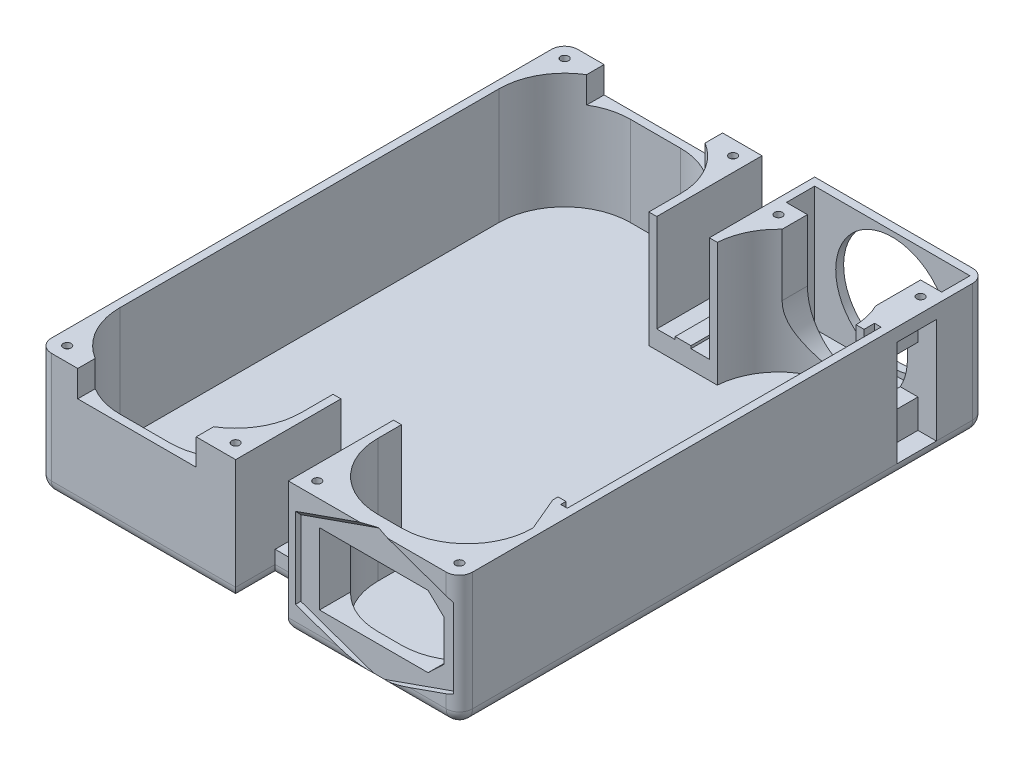
from build123d import *
from build123d.topology import SkipClean

# Parameters (mm, degrees)
BOSS_BASE_DEPTH     = 3
MOUNT_POINTS_W      = 20
MOUNT_POINTS_H      = 25
BOSS_2040REST_DEPTH = 7
SKETCH5_W           = 6
SKETCH5_H           = 25
BOSS_2040RAIL_DEPTH = 1
CUT_EXTRUDE1_REACH  = 133.704
SKETCH6_R           = 1.65
SKETCH7_R           = 3
CUT_EXTRUDE2_DEPTH  = 8
BOSS_EXTRUDE4_DEPTH = 44
BOSS_EXTRUDE5_DEPTH = 47
FILLET2_R           = 25
SKETCH14_W          = 59
SKETCH14_H          = 3
BOSS_EXTRUDE6_DEPTH = 47
CUT_EXTRUDE4_DEPTH  = 2
CHAMFER1_SIZE       = 2
CUT_EXTRUDE5_REACH  = 223.199
SKETCH15_R          = 21.5
CUT_EXTRUDE6_DEPTH  = 209.099885872
CUT_EXTRUDE7_REACH  = 210.1
SKETCH16_W          = 43
SKETCH16_H          = 23.5
BOSS_EXTRUDE7_DEPTH = 47
SKETCH20_W          = 45
SKETCH20_H          = 10
CUT_EXTRUDE10_DEPTH = 223.99103121
FILLET3_START       = 2
FILLET3_DEPTH       = 48
FILLET3_2_DEPTH     = 3.641900088
FILLET3_START_2     = 5.641900088
FILLET3_3_DEPTH     = 20.858099912
FILLET3_START_3     = -83.25
FILLET3_4_DEPTH     = 14.061537587
FILLET4_R           = 25
FILLET5_R           = 5
SKETCH23_W          = 15
SKETCH23_H          = 40
CUT_EXTRUDE11_DEPTH = 7
SKETCH19_R          = 1.5
SCREWHOLES_DEPTH    = 5
CUT_EXTRUDE12_REACH = 191.497
SKETCH24_W          = 15
SKETCH24_H          = 18


with BuildPart() as part:
    # base → boss-base (new body)
    with BuildSketch(Plane(origin=(0, 0, 0), x_dir=(1, 0, 0), z_dir=(0, 1, 0))):
        Polygon((10, 85), (-10, 85), (-10, 100), (-85, 100), (-85, -100), (-10, -100), (-10, -85), (10, -85), (10, -100), (75, -100), (75, 100), (10, 100), align=None)
    extrude(amount=BOSS_BASE_DEPTH)

    # mount points → Boss-2040rest (add)
    with BuildSketch(Plane(origin=(0, 3, 0), x_dir=(1, 0, 0), z_dir=(0, 1, 0))):
        with Locations((0, 72.5)):
            Rectangle(MOUNT_POINTS_W, MOUNT_POINTS_H)
        with Locations((0, -72.5)):
            Rectangle(MOUNT_POINTS_W, MOUNT_POINTS_H)
    extrude(amount=BOSS_2040REST_DEPTH)

    # Sketch5 → Boss-2040rail (add)
    with BuildSketch(Plane(origin=(0, 10, 0), x_dir=(1, 0, 0), z_dir=(0, 1, 0))):
        with Locations((0, -72.5)):
            Rectangle(SKETCH5_W, SKETCH5_H)
        with Locations((0, 72.5)):
            Rectangle(SKETCH5_W, SKETCH5_H)
    extrude(amount=BOSS_2040RAIL_DEPTH)

    # Sketch6 → Cut-Extrude1 (cut, up to next)
    with BuildSketch(Plane(origin=(0, 11, 0), x_dir=(1, 0, 0), z_dir=(0, 1, 0)), mode=Mode.PRIVATE) as cut_extrude1_sk1:
        with Locations(Location((0, 72.5, 0), (0, 0, 270))):
            Circle(SKETCH6_R)
    cut_extrude1_tool1 = extrude(cut_extrude1_sk1.sketch, amount=-CUT_EXTRUDE1_REACH, mode=Mode.PRIVATE) & part.part
    # Sketch6 → Cut-Extrude1 (cut, up to next)
    with BuildSketch(Plane(origin=(0, 11, 0), x_dir=(1, 0, 0), z_dir=(0, 1, 0)), mode=Mode.PRIVATE) as cut_extrude1_sk2:
        with Locations(Location((0, -72.5, 0), (0, 0, 270))):
            Circle(SKETCH6_R)
    cut_extrude1_tool2 = extrude(cut_extrude1_sk2.sketch, amount=-CUT_EXTRUDE1_REACH, mode=Mode.PRIVATE) & part.part
    add(cut_extrude1_tool1.solids().sort_by_distance((0, 11, -72.5))[0], mode=Mode.SUBTRACT)
    add(cut_extrude1_tool2.solids().sort_by_distance((0, 11, 72.5))[0], mode=Mode.SUBTRACT)

    # Sketch7 → Cut-Extrude2 (cut)
    with BuildSketch(Plane.XZ):
        with Locations(Location((0, 72.5, 0), (0, 0, 270))):
            Circle(SKETCH7_R)
        with Locations(Location((0, -72.5, 0), (0, 0, 270))):
            Circle(SKETCH7_R)
    extrude(amount=-CUT_EXTRUDE2_DEPTH, mode=Mode.SUBTRACT)

    # Sketch9 → Boss-Extrude4 (add)
    with BuildSketch(Plane(origin=(0, 3, 0), x_dir=(1, 0, 0), z_dir=(0, 1, 0))):
        Polygon((-10, 100), (-85, 100), (-85, -100), (-10, -100), (-10, -85), (-10, -60), (-13, -60), (-13, -85), (-13, -97), (-82, -97), (-82, 97), (-13, 97), (-13, 85), (-13, 60), (-10, 60), (-10, 85), align=None)
    extrude(amount=BOSS_EXTRUDE4_DEPTH)

    # Sketch10 → Boss-Extrude5 (add)
    with BuildSketch(Plane(origin=(0, 3, 0), x_dir=(1, 0, 0), z_dir=(0, 1, 0))):
        Polygon((10, -85), (10, -60), (13, -60), (13, -85), (13, -94), (72, -94), (72, 97), (13, 97), (13, 85), (13, 60), (10, 60), (10, 85), (10, 100), (75, 100), (75, -100), (10, -100), align=None)
    extrude(amount=BOSS_EXTRUDE5_DEPTH)

    # Fillet2
    fillet2_edges = [part.edges().sort_by_distance(p)[0] for p in [
        (72, 26.5, 94),
        (13, 26.5, 94),
    ]]
    fillet(fillet2_edges, radius=FILLET2_R)

    # Sketch14 → Boss-Extrude6 (add)
    with BuildSketch(Plane(origin=(0, 3, 0), x_dir=(1, 0, 0), z_dir=(0, 1, 0))):
        with Locations((42.5, 84.75)):
            Rectangle(SKETCH14_W, SKETCH14_H)
    extrude(amount=BOSS_EXTRUDE6_DEPTH)

    # Sketch11 → Cut-Extrude4 (cut)
    with BuildSketch(Plane.XY.offset(100)):
        Polygon((12.75, 10.75), (12.75, 39.25), (42.5, 49.75), (72.25, 39.25), (72.25, 10.75), (42.5, 0.25), align=None)
    extrude(amount=-CUT_EXTRUDE4_DEPTH, mode=Mode.SUBTRACT)

    # Chamfer1
    # the kernel refuses this chamfer: 2 mm, written as the material it takes off along each edge
    with BuildSketch(Plane(origin=(37.649855603, 51.46181567, 100), x_dir=(0.3328201177351373, 0.9429903335828895, -7.105427357600988e-15), z_dir=(0.9429903335828896, -0.33282011773513737, 0))) as chamfer1_piece_1_section:
        Polygon((CHAMFER1_SIZE, 0), (0, -CHAMFER1_SIZE), (0, 0), align=None)
    chamfer1_piece_1 = extrude(amount=41.835305612, mode=Mode.PRIVATE)
    chamfer1_piece_1 = split(chamfer1_piece_1, bisect_by=Plane(origin=(38.724349131, 48.41741734, 100), z_dir=(0.3328201177351376, -0.9429903335828895, 0)), keep=Keep.TOP, mode=Mode.PRIVATE)
    chamfer1_piece_1 = split(chamfer1_piece_1, bisect_by=Plane(origin=(72.25, 51.46181567, 100), z_dir=(-1, 0, 0)), keep=Keep.TOP, mode=Mode.PRIVATE)
    add(chamfer1_piece_1, mode=Mode.SUBTRACT)
    with BuildSketch(Plane(origin=(7.899855603, 37.53818433, 100), x_dir=(-0.3328201177351376, 0.9429903335828896, 0), z_dir=(0.9429903335828895, 0.3328201177351376, 0))) as chamfer1_piece_2_section:
        Polygon((CHAMFER1_SIZE, 0), (0, -CHAMFER1_SIZE), (0, 0), align=None)
    chamfer1_piece_2 = extrude(amount=41.835305612, mode=Mode.PRIVATE)
    chamfer1_piece_2 = split(chamfer1_piece_2, bisect_by=Plane(origin=(12.75, 37.53818433, 100), z_dir=(1, 0, 0)), keep=Keep.TOP, mode=Mode.PRIVATE)
    chamfer1_piece_2 = split(chamfer1_piece_2, bisect_by=Plane(origin=(15.565118361, 59.256428814, 100), z_dir=(-0.33282011773513737, -0.9429903335828896, 0)), keep=Keep.TOP, mode=Mode.PRIVATE)
    add(chamfer1_piece_2, mode=Mode.SUBTRACT)
    with BuildSketch(Plane(origin=(7.899855603, 37.53818433, 100), x_dir=(-0.3328201177351376, 0.9429903335828896, 0), z_dir=(0.9429903335828895, 0.3328201177351376, 0))) as chamfer1_piece_3a_section:
        Polygon((CHAMFER1_SIZE, 0), (0, -CHAMFER1_SIZE), (0, 0), align=None)
    chamfer1_piece_3a = extrude(amount=41.835305612, mode=Mode.PRIVATE)
    chamfer1_piece_3a = split(chamfer1_piece_3a, bisect_by=Plane(origin=(7.899855603, 50, 100), z_dir=(0, -1, 0)), keep=Keep.TOP, mode=Mode.PRIVATE)
    chamfer1_piece_3a = split(chamfer1_piece_3a, bisect_by=Plane(origin=(15.565118361, 59.256428814, 100), z_dir=(0.33282011773513737, 0.9429903335828896, 0)), keep=Keep.TOP, mode=Mode.PRIVATE)
    with BuildSketch(Plane(origin=(37.649855603, 51.46181567, 100), x_dir=(0.3328201177351373, 0.9429903335828895, -7.105427357600988e-15), z_dir=(0.9429903335828896, -0.33282011773513737, 0))) as chamfer1_piece_3b_section:
        Polygon((CHAMFER1_SIZE, 0), (0, -CHAMFER1_SIZE), (0, 0), align=None)
    chamfer1_piece_3b = extrude(amount=41.835305612, mode=Mode.PRIVATE)
    chamfer1_piece_3b = split(chamfer1_piece_3b, bisect_by=Plane(origin=(37.649855603, 50, 100), z_dir=(0, -1, 0)), keep=Keep.TOP, mode=Mode.PRIVATE)
    chamfer1_piece_3b = split(chamfer1_piece_3b, bisect_by=Plane(origin=(38.724349131, 48.41741734, 100), z_dir=(-0.3328201177351376, 0.9429903335828895, 0)), keep=Keep.TOP, mode=Mode.PRIVATE)
    chamfer1_piece_3 = chamfer1_piece_3a & chamfer1_piece_3b
    add(chamfer1_piece_3, mode=Mode.SUBTRACT)

    # Sketch12 → Cut-Extrude5 (cut, up to next)
    with BuildSketch(Plane.XY.offset(98), mode=Mode.PRIVATE) as cut_extrude5_sk1:
        Polygon((19.85, 11.45), (19.85, 38.55), (61.1, 38.55), (67.25, 32.7), (67.25, 17.3), (61.1, 11.45), align=None)
    cut_extrude5_tool1 = extrude(cut_extrude5_sk1.sketch, amount=-CUT_EXTRUDE5_REACH, mode=Mode.PRIVATE) & part.part
    add(cut_extrude5_tool1.solids().sort_by_distance((42.926152, 25, 98))[0], mode=Mode.SUBTRACT)

    # Sketch15 → Cut-Extrude6 (cut, through all)
    with BuildSketch(Plane.XY.offset(-83.25)):
        with Locations((42.5, 26.5)):
            Circle(SKETCH15_R)
    extrude(amount=-CUT_EXTRUDE6_DEPTH, mode=Mode.SUBTRACT)

    # Sketch16 → Cut-Extrude7 (cut, up to next)
    with BuildSketch(Plane.XY.offset(-83.25), mode=Mode.PRIVATE) as cut_extrude7_sk1:
        with Locations((42.5, 38.25)):
            Rectangle(SKETCH16_W, SKETCH16_H)
    cut_extrude7_tool1 = extrude(cut_extrude7_sk1.sketch, amount=-CUT_EXTRUDE7_REACH, mode=Mode.PRIVATE) & part.part
    add(cut_extrude7_tool1.solids().sort_by_distance((42.5, 38.25, -83.25))[0], mode=Mode.SUBTRACT)

    # Sketch17 → Boss-Extrude7 (add)
    with BuildSketch(Plane(origin=(0, 3, 0), x_dir=(1, 0, 0), z_dir=(0, 1, 0))):
        Polygon((72, 63.25), (69.5, 63.25), (69.5, 59.25), (66.5, 59.25), (66.5, 83.25), (72, 83.25), align=None)
        Polygon((72, -56), (69.5, -56), (69.5, -54), (66.5, -54), (66.5, -56), (72, -69), align=None)
    extrude(amount=BOSS_EXTRUDE7_DEPTH)

    # Sketch20 → Cut-Extrude10 (cut, through all)
    with BuildSketch(Plane.XY.offset(100)):
        with Locations((-47.5, 42)):
            Rectangle(SKETCH20_W, SKETCH20_H)
    extrude(amount=-CUT_EXTRUDE10_DEPTH, mode=Mode.SUBTRACT)

    # Fillet3: read off the stored shape, not the designer's step
    # Fillet3 outline → Fillet3 (add)
    with BuildSketch(Plane(origin=(0, 0, 0), x_dir=(1, 0, 0), z_dir=(0, 1, 0)).offset(FILLET3_START)):
        with BuildLine():
            Line((21, 76.636987153), (21, 83.25))
            Line((21, 83.25), (13, 83.25))
            Line((13, 83.25), (13, 60))
            ThreePointArc((13, 60), (15.408130248, 69.083954167), (21, 76.636987153))
        make_face()
        with BuildLine():
            Line((64, 83.25), (64, 69.188462413))
            ThreePointArc((64, 69.188462413), (65.764714208, 64.348706518), (66.5, 59.25))
            Line((66.5, 59.25), (66.5, 83.25))
            Line((66.5, 83.25), (64, 83.25))
        make_face()
    extrude(amount=FILLET3_DEPTH)

    # Fillet3 2 outline → Fillet3 2 (add)
    with BuildSketch(Plane(origin=(0, 0, 0), x_dir=(1, 0, 0), z_dir=(0, 1, 0)).offset(FILLET3_START)):
        with BuildLine():
            Line((37.938674784, 83.25), (21, 83.25))
            Line((21, 83.25), (21, 76.636987153))
            ThreePointArc((21, 76.636987153), (28.84677396, 81.538137311), (37.938674784, 83.25))
        make_face()
        with BuildLine():
            Line((64, 83.25), (41.520008006, 83.25))
            ThreePointArc((41.520008006, 83.25), (54.77780646, 79.445064995), (64, 69.188462413))
            Line((64, 69.188462413), (64, 83.25))
        make_face()
    extrude(amount=FILLET3_2_DEPTH)

    # Fillet3 3 outline → Fillet3 3 (add)
    with BuildSketch(Plane(origin=(0, 0, 0), x_dir=(1, 0, 0), z_dir=(0, 1, 0)).offset(FILLET3_START_2)):
        with BuildLine():
            ThreePointArc((41.520008006, 83.25), (54.77780646, 79.445064995), (64, 69.188462413))
            Line((64, 69.188462413), (64, 83.25))
            Line((64, 83.25), (41.520008006, 83.25))
        make_face()
        with BuildLine():
            Line((21, 83.25), (21, 76.636987153))
            ThreePointArc((21, 76.636987153), (28.84677396, 81.538137311), (37.938674784, 83.25))
            Line((37.938674784, 83.25), (21, 83.25))
        make_face()
    extrude(amount=FILLET3_3_DEPTH)

    # Fillet3 4 outline → Fillet3 4 (cut)
    with SkipClean():  # the faces are left unmerged after this step: merging them gives an invalid solid
        with BuildSketch(Plane.XY.offset(FILLET3_START_3)):
            with BuildLine():
                Line((64, 26.5), (21, 26.5))
                ThreePointArc((21, 26.5), (42.5, 5), (64, 26.5))
            make_face()
        extrude(amount=FILLET3_4_DEPTH, mode=Mode.SUBTRACT)
    add(part.part.scale(1), mode=Mode.REPLACE)  # the faces are merged on a copy

    # Fillet4
    fillet4_edges = [part.edges().sort_by_distance(p)[0] for p in [
        (-13, 25, -97),
        (-82, 25, -97),
        (-13, 25, 97),
        (-82, 25, 97),
    ]]
    fillet(fillet4_edges, radius=FILLET4_R)

    # Fillet5
    # the kernel refuses this fillet: 5 mm, written as the material it takes off along each edge
    with BuildSketch(Plane(origin=(70, 5, -95), x_dir=(1, 0, 0), z_dir=(0, 0, -1))) as fillet5_piece_1_section:
        Polygon((0, 0), (FILLET5_R, 0), (FILLET5_R, FILLET5_R), (0, FILLET5_R), align=None)
    fillet5_piece_1 = extrude(amount=FILLET5_R, mode=Mode.PRIVATE)
    fillet5_piece_1 = fillet5_piece_1 - Plane(origin=(70, 5, -95), x_dir=(-0.7071067811865475, 0.7071067811865475, 0), z_dir=(0, 0, -1)) * Sphere(FILLET5_R, mode=Mode.PRIVATE)
    add(fillet5_piece_1, mode=Mode.SUBTRACT)
    with BuildSketch(Plane(origin=(70, 5, 95), x_dir=(0, 0, 1), z_dir=(1, 0, 0))) as fillet5_piece_2_section:
        Polygon((0, 0), (FILLET5_R, 0), (FILLET5_R, FILLET5_R), (0, FILLET5_R), align=None)
    fillet5_piece_2 = extrude(amount=FILLET5_R, mode=Mode.PRIVATE)
    fillet5_piece_2 = fillet5_piece_2 - Plane(origin=(70, 5, 95), x_dir=(0, 0.7071067811865475, -0.7071067811865475), z_dir=(1, 0, 0)) * Sphere(FILLET5_R, mode=Mode.PRIVATE)
    add(fillet5_piece_2, mode=Mode.SUBTRACT)
    with BuildSketch(Plane(origin=(-80, 5, -95), x_dir=(0, 0, -1), z_dir=(0, -1, 0))) as fillet5_piece_3_section:
        Polygon((0, 0), (FILLET5_R, 0), (FILLET5_R, -FILLET5_R), (0, -FILLET5_R), align=None)
    fillet5_piece_3 = extrude(amount=FILLET5_R, mode=Mode.PRIVATE)
    fillet5_piece_3 = fillet5_piece_3 - Plane(origin=(-80, 5, -95), x_dir=(0.7071067811865477, 0, 0.7071067811865474), z_dir=(0, -1, 0)) * Sphere(FILLET5_R, mode=Mode.PRIVATE)
    add(fillet5_piece_3, mode=Mode.SUBTRACT)
    with BuildSketch(Plane(origin=(-80, 5, 95), x_dir=(0, -1, 0), z_dir=(0, 0, 1))) as fillet5_piece_4_section:
        Polygon((0, 0), (FILLET5_R, 0), (FILLET5_R, -FILLET5_R), (0, -FILLET5_R), align=None)
    fillet5_piece_4 = extrude(amount=FILLET5_R, mode=Mode.PRIVATE)
    fillet5_piece_4 = fillet5_piece_4 - Plane(origin=(-80, 5, 95), x_dir=(0.7071067811865475, 0.7071067811865475, 0), z_dir=(0, 0, 1)) * Sphere(FILLET5_R, mode=Mode.PRIVATE)
    add(fillet5_piece_4, mode=Mode.SUBTRACT)
    with BuildSketch(Plane(origin=(75, 62.5, -100), x_dir=(-1, 0, 0), z_dir=(0, -1, 0))) as fillet5_piece_5:
        with BuildLine():
            CenterArc((FILLET5_R, -FILLET5_R), FILLET5_R, 90, 90)
            Line((0, -FILLET5_R), (0, 0))
            Line((0, 0), (FILLET5_R, 0))
        make_face()
    extrude(amount=57.5, mode=Mode.SUBTRACT)
    with BuildSketch(Plane(origin=(75, 62.5, 100), x_dir=(-1, 0, 0), z_dir=(0, -1, 0))) as fillet5_piece_6:
        with BuildLine():
            CenterArc((FILLET5_R, FILLET5_R), FILLET5_R, 180, 90)
            Line((0, FILLET5_R), (0, 0))
            Line((0, 0), (FILLET5_R, 0))
        make_face()
    extrude(amount=57.5, mode=Mode.SUBTRACT)
    with BuildSketch(Plane(origin=(-85, 5, -100), x_dir=(1, 0, 0), z_dir=(0, 1, 0))) as fillet5_piece_7:
        with BuildLine():
            CenterArc((FILLET5_R, -FILLET5_R), FILLET5_R, 90, 90)
            Line((0, -FILLET5_R), (0, 0))
            Line((0, 0), (FILLET5_R, 0))
        make_face()
    extrude(amount=54.5, mode=Mode.SUBTRACT)
    with BuildSketch(Plane(origin=(-85, 5, 100), x_dir=(1, 0, 0), z_dir=(0, 1, 0))) as fillet5_piece_8:
        with BuildLine():
            CenterArc((FILLET5_R, FILLET5_R), FILLET5_R, 180, 90)
            Line((0, FILLET5_R), (0, 0))
            Line((0, 0), (FILLET5_R, 0))
        make_face()
    extrude(amount=54.5, mode=Mode.SUBTRACT)
    with BuildSketch(Plane(origin=(-80, 0, 100), x_dir=(0, 1, 0), z_dir=(1, 0, 0))) as fillet5_piece_9:
        with BuildLine():
            CenterArc((FILLET5_R, -FILLET5_R), FILLET5_R, 90, 90)
            Line((0, -FILLET5_R), (0, 0))
            Line((0, 0), (FILLET5_R, 0))
        make_face()
    extrude(amount=82.5, mode=Mode.SUBTRACT)
    with BuildSketch(Plane(origin=(-10, 0, 112.5), x_dir=(0, 1, 0), z_dir=(0, 0, -1)), Plane(origin=(10, 0, 85), x_dir=(0, 1, 0), z_dir=(0, 0, 1)), Plane(origin=(10, 0, -112.5), x_dir=(0, 1, 0), z_dir=(0, 0, 1)), Plane(origin=(-10, 0, -85), x_dir=(0, 1, 0), z_dir=(0, 0, -1))) as fillet5_piece_10:
        with BuildLine():
            CenterArc((FILLET5_R, -FILLET5_R), FILLET5_R, 90, 90)
            Line((0, -FILLET5_R), (0, 0))
            Line((0, 0), (FILLET5_R, 0))
        make_face()
    extrude(amount=27.5, mode=Mode.SUBTRACT)
    with BuildSketch(Plane(origin=(-10, 0, 85), x_dir=(0, 1, 0), z_dir=(1, 0, 0))) as fillet5_piece_11:
        with BuildLine():
            CenterArc((FILLET5_R, -FILLET5_R), FILLET5_R, 90, 90)
            Line((0, -FILLET5_R), (0, 0))
            Line((0, 0), (FILLET5_R, 0))
        make_face()
    extrude(amount=20, mode=Mode.SUBTRACT)
    with BuildSketch(Plane(origin=(-2.5, 0, 100), x_dir=(0, 1, 0), z_dir=(1, 0, 0))) as fillet5_piece_12:
        with BuildLine():
            CenterArc((FILLET5_R, -FILLET5_R), FILLET5_R, 90, 90)
            Line((0, -FILLET5_R), (0, 0))
            Line((0, 0), (FILLET5_R, 0))
        make_face()
    extrude(amount=72.5, mode=Mode.SUBTRACT)
    with BuildSketch(Plane(origin=(75, 0, 95), x_dir=(-1, 0, 0), z_dir=(0, 0, -1)), Plane(origin=(-85, 0, -95), x_dir=(1, 0, 0), z_dir=(0, 0, 1))) as fillet5_piece_13:
        with BuildLine():
            CenterArc((FILLET5_R, FILLET5_R), FILLET5_R, 180, 90)
            Line((0, FILLET5_R), (0, 0))
            Line((0, 0), (FILLET5_R, 0))
        make_face()
    extrude(amount=190, mode=Mode.SUBTRACT)
    with BuildSketch(Plane(origin=(70, 0, -100), x_dir=(0, 0, 1), z_dir=(-1, 0, 0))) as fillet5_piece_14:
        with BuildLine():
            CenterArc((FILLET5_R, FILLET5_R), FILLET5_R, 180, 90)
            Line((0, FILLET5_R), (0, 0))
            Line((0, 0), (FILLET5_R, 0))
        make_face()
    extrude(amount=72.5, mode=Mode.SUBTRACT)
    with BuildSketch(Plane(origin=(10, 0, -85), x_dir=(0, 0, 1), z_dir=(-1, 0, 0))) as fillet5_piece_15:
        with BuildLine():
            CenterArc((FILLET5_R, FILLET5_R), FILLET5_R, 180, 90)
            Line((0, FILLET5_R), (0, 0))
            Line((0, 0), (FILLET5_R, 0))
        make_face()
    extrude(amount=20, mode=Mode.SUBTRACT)
    with BuildSketch(Plane(origin=(2.5, 0, -100), x_dir=(0, 0, 1), z_dir=(-1, 0, 0))) as fillet5_piece_16:
        with BuildLine():
            CenterArc((FILLET5_R, FILLET5_R), FILLET5_R, 180, 90)
            Line((0, FILLET5_R), (0, 0))
            Line((0, 0), (FILLET5_R, 0))
        make_face()
    extrude(amount=82.5, mode=Mode.SUBTRACT)
    with BuildSketch(Plane(origin=(-10, 0, 112.5), x_dir=(0, 1, 0), z_dir=(0, 0, -1))) as fillet5_piece_17a_section:
        with BuildLine():
            CenterArc((FILLET5_R, -FILLET5_R), FILLET5_R, 90, 90)
            Line((0, -FILLET5_R), (0, 0))
            Line((0, 0), (FILLET5_R, 0))
        make_face()
    fillet5_piece_17a = extrude(amount=40, mode=Mode.PRIVATE)
    fillet5_piece_17a = split(fillet5_piece_17a, bisect_by=Plane(origin=(-10, 0, 85), z_dir=(0, 0, -1)), keep=Keep.TOP, mode=Mode.PRIVATE)
    with BuildSketch(Plane(origin=(-22.5, 0, 85), x_dir=(0, 1, 0), z_dir=(1, 0, 0))) as fillet5_piece_17b_section:
        with BuildLine():
            CenterArc((FILLET5_R, -FILLET5_R), FILLET5_R, 90, 90)
            Line((0, -FILLET5_R), (0, 0))
            Line((0, 0), (FILLET5_R, 0))
        make_face()
    fillet5_piece_17b = extrude(amount=32.5, mode=Mode.PRIVATE)
    fillet5_piece_17b = split(fillet5_piece_17b, bisect_by=Plane(origin=(-10, 0, 85), z_dir=(-1, 0, 0)), keep=Keep.TOP, mode=Mode.PRIVATE)
    fillet5_piece_17 = fillet5_piece_17a & fillet5_piece_17b
    add(fillet5_piece_17, mode=Mode.SUBTRACT)
    with BuildSketch(Plane(origin=(10, 0, 72.5), x_dir=(0, 1, 0), z_dir=(0, 0, 1))) as fillet5_piece_18a_section:
        with BuildLine():
            CenterArc((FILLET5_R, -FILLET5_R), FILLET5_R, 90, 90)
            Line((0, -FILLET5_R), (0, 0))
            Line((0, 0), (FILLET5_R, 0))
        make_face()
    fillet5_piece_18a = extrude(amount=40, mode=Mode.PRIVATE)
    fillet5_piece_18a = split(fillet5_piece_18a, bisect_by=Plane(origin=(10, 0, 85), z_dir=(0, 0, -1)), keep=Keep.TOP, mode=Mode.PRIVATE)
    with BuildSketch(Plane(origin=(-10, 0, 85), x_dir=(0, 1, 0), z_dir=(1, 0, 0))) as fillet5_piece_18b_section:
        with BuildLine():
            CenterArc((FILLET5_R, -FILLET5_R), FILLET5_R, 90, 90)
            Line((0, -FILLET5_R), (0, 0))
            Line((0, 0), (FILLET5_R, 0))
        make_face()
    fillet5_piece_18b = extrude(amount=32.5, mode=Mode.PRIVATE)
    fillet5_piece_18b = split(fillet5_piece_18b, bisect_by=Plane(origin=(10, 0, 85), z_dir=(1, 0, 0)), keep=Keep.TOP, mode=Mode.PRIVATE)
    fillet5_piece_18 = fillet5_piece_18a & fillet5_piece_18b
    add(fillet5_piece_18, mode=Mode.SUBTRACT)
    with BuildSketch(Plane(origin=(10, 0, -112.5), x_dir=(0, 1, 0), z_dir=(0, 0, 1))) as fillet5_piece_19a_section:
        with BuildLine():
            CenterArc((FILLET5_R, -FILLET5_R), FILLET5_R, 90, 90)
            Line((0, -FILLET5_R), (0, 0))
            Line((0, 0), (FILLET5_R, 0))
        make_face()
    fillet5_piece_19a = extrude(amount=40, mode=Mode.PRIVATE)
    fillet5_piece_19a = split(fillet5_piece_19a, bisect_by=Plane(origin=(10, 0, -85), z_dir=(0, 0, 1)), keep=Keep.TOP, mode=Mode.PRIVATE)
    with BuildSketch(Plane(origin=(22.5, 0, -85), x_dir=(0, 0, 1), z_dir=(-1, 0, 0))) as fillet5_piece_19b_section:
        with BuildLine():
            CenterArc((FILLET5_R, FILLET5_R), FILLET5_R, 180, 90)
            Line((0, FILLET5_R), (0, 0))
            Line((0, 0), (FILLET5_R, 0))
        make_face()
    fillet5_piece_19b = extrude(amount=32.5, mode=Mode.PRIVATE)
    fillet5_piece_19b = split(fillet5_piece_19b, bisect_by=Plane(origin=(10, 0, -85), z_dir=(1, 0, 0)), keep=Keep.TOP, mode=Mode.PRIVATE)
    fillet5_piece_19 = fillet5_piece_19a & fillet5_piece_19b
    add(fillet5_piece_19, mode=Mode.SUBTRACT)
    with BuildSketch(Plane(origin=(-10, 0, -72.5), x_dir=(0, 1, 0), z_dir=(0, 0, -1))) as fillet5_piece_20a_section:
        with BuildLine():
            CenterArc((FILLET5_R, -FILLET5_R), FILLET5_R, 90, 90)
            Line((0, -FILLET5_R), (0, 0))
            Line((0, 0), (FILLET5_R, 0))
        make_face()
    fillet5_piece_20a = extrude(amount=40, mode=Mode.PRIVATE)
    fillet5_piece_20a = split(fillet5_piece_20a, bisect_by=Plane(origin=(-10, 0, -85), z_dir=(0, 0, 1)), keep=Keep.TOP, mode=Mode.PRIVATE)
    with BuildSketch(Plane(origin=(10, 0, -85), x_dir=(0, 0, 1), z_dir=(-1, 0, 0))) as fillet5_piece_20b_section:
        with BuildLine():
            CenterArc((FILLET5_R, FILLET5_R), FILLET5_R, 180, 90)
            Line((0, FILLET5_R), (0, 0))
            Line((0, 0), (FILLET5_R, 0))
        make_face()
    fillet5_piece_20b = extrude(amount=32.5, mode=Mode.PRIVATE)
    fillet5_piece_20b = split(fillet5_piece_20b, bisect_by=Plane(origin=(-10, 0, -85), z_dir=(-1, 0, 0)), keep=Keep.TOP, mode=Mode.PRIVATE)
    fillet5_piece_20 = fillet5_piece_20a & fillet5_piece_20b
    add(fillet5_piece_20, mode=Mode.SUBTRACT)

    # Sketch23 → Cut-Extrude11 (cut)
    with BuildSketch(Plane(origin=(75, 0, 0), x_dir=(0, 0, -1), z_dir=(1, 0, 0))):
        with Locations((73.75, 25)):
            Rectangle(SKETCH23_W, SKETCH23_H)
    extrude(amount=-CUT_EXTRUDE11_DEPTH, mode=Mode.SUBTRACT)

    # Sketch19 → screwholes (cut)
    with BuildSketch(Plane(origin=(0, 50, 0), x_dir=(1, 0, 0), z_dir=(0, 1, 0))):
        with Locations(Location((-79.5, 94.5, 0), (0, 0, 270))):
            Circle(SKETCH19_R)
        with Locations(Location((-79.5, -94.5, 0), (0, 0, 270))):
            Circle(SKETCH19_R)
        with Locations(Location((-15.5, -94.5, 0), (0, 0, 270))):
            Circle(SKETCH19_R)
        with Locations(Location((-15.5, 94.5, 0), (0, 0, 270))):
            Circle(SKETCH19_R)
        with Locations(Location((15.5, -94.5, 0), (0, 0, 270))):
            Circle(SKETCH19_R)
        with Locations(Location((15.5, 80.75, 0), (0, 0, 270))):
            Circle(SKETCH19_R)
        with Locations(Location((69.5, -94.5, 0), (0, 0, 90))):
            Circle(SKETCH19_R)
        with Locations(Location((69.5, 80.75, 0), (0, 0, 180))):
            Circle(SKETCH19_R)
    extrude(amount=-SCREWHOLES_DEPTH, mode=Mode.SUBTRACT)

    # Sketch24 → Cut-Extrude12 (cut, up to next)
    with BuildSketch(Plane(origin=(68, 0, 0), x_dir=(0, 0, -1), z_dir=(1, 0, 0)), mode=Mode.PRIVATE) as cut_extrude12_sk1:
        with Locations((73.75, 25)):
            Rectangle(SKETCH24_W, SKETCH24_H)
    cut_extrude12_tool1 = extrude(cut_extrude12_sk1.sketch, amount=-CUT_EXTRUDE12_REACH, mode=Mode.PRIVATE) & part.part
    add(cut_extrude12_tool1.solids().sort_by_distance((68, 25, -73.75))[0], mode=Mode.SUBTRACT)


solid = part.part
